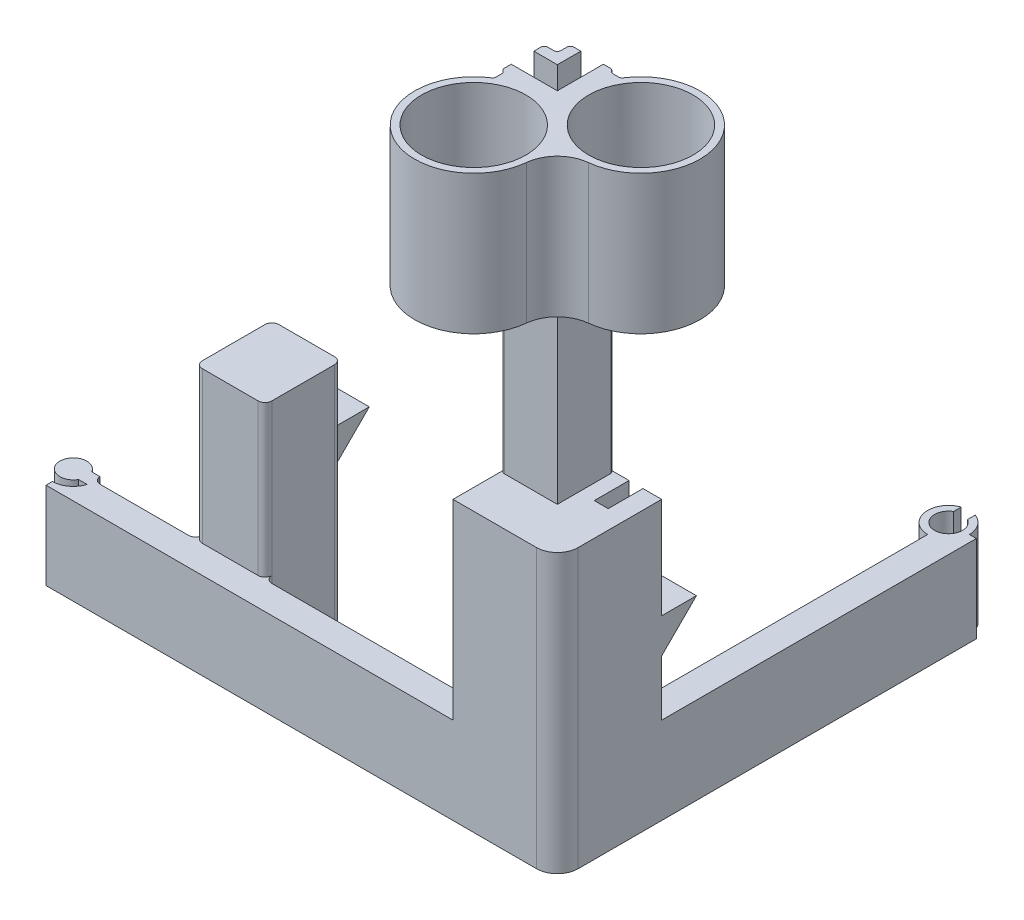
from build123d import *
from build123d.topology import SkipClean

# Parameters (mm, degrees)
SKETCH1_W                 = 30
SKETCH1_H                 = 30
BOSS_EXTRUDE1_DEPTH       = 80
SKETCH2_R                 = 6
BOSS_EXTRUDE2_DEPTH       = 22
CUT_EXTRUDE1_DEPTH        = 83.764726786
BOSS_EXTRUDE3_DEPTH       = 100
BOSS_EXTRUDE5_DEPTH       = 2
BOSS_EXTRUDE6_DEPTH       = 23
BOSS_EXTRUDE7_DEPTH       = 25
FILLET1_R                 = 2
SKETCH11_R                = 6.055782361
CUT_EXTRUDE2_DEPTH        = 2.125
SKETCH12_W                = 13.25
SKETCH12_H                = 8.5
CUT_EXTRUDE4_DEPTH        = 13.25
CUT_EXTRUDE5_REACH        = 204.341
SKETCH15_W                = 3.75
SKETCH15_H                = 3.75
FILLET2_R                 = 1
CUT_EXTRUDE7_START        = 22
SKETCH16_R                = 6
CUT_EXTRUDE7_DEPTH        = 22
SKETCH17_R                = 15
BOSS_EXTRUDE8_DEPTH       = 40
FILLET3_R                 = 1
SKETCH18_R                = 15
SKETCH18_R_2              = 7.5
BOSS_EXTRUDE9_DEPTH       = 2
SKETCH22_W                = 4
SKETCH22_H                = 10
CUT_EXTRUDE8_DEPTH        = 25
BOSS_EXTRUDE10_REACH      = 253.678
SKETCH23_W                = 20
SKETCH23_H                = 22
SKETCH24_W                = 15
SKETCH24_H                = 17
CUT_EXTRUDE9_DEPTH        = 66
FILLET4_R                 = 2
FILLET5_R                 = 2
CHAMFER1_SIZE             = 7
BOSS_EXTRUDE11_DEPTH      = 30
BOSS_EXTRUDE12_DEPTH      = 7.999995
BOSS_EXTRUDE12_DEPTH_BACK = 8.000005


with BuildPart() as part:
    # Sketch1 → Boss-Extrude1 (new body)
    with BuildSketch(Plane(origin=(0, 0, 0), x_dir=(1, 0, 0), z_dir=(0, 1, 0))):
        Rectangle(SKETCH1_W, SKETCH1_H)
    extrude(amount=BOSS_EXTRUDE1_DEPTH)

    # Sketch2 → Boss-Extrude2 (add)
    with BuildSketch(Plane(origin=(0, 80, 0), x_dir=(1, 0, 0), z_dir=(0, 1, 0))):
        with Locations(Location((9, -9, 0), (0, 0, 270))):
            Circle(SKETCH2_R)
    extrude(amount=BOSS_EXTRUDE2_DEPTH)

    # Sketch3 → Cut-Extrude1 (cut, through all)
    with BuildSketch(Plane(origin=(0, 80, 0), x_dir=(1, 0, 0), z_dir=(0, 1, 0))):
        with BuildLine():
            Line((9, -15), (15, -15))
            Line((15, -15), (15, -9))
            ThreePointArc((15, -9), (13.242640687, -13.242640687), (9, -15))
        make_face()
    extrude(amount=-CUT_EXTRUDE1_DEPTH, mode=Mode.SUBTRACT)

    # Sketch4 → Boss-Extrude3 (add)
    with BuildSketch(Plane(origin=(0, 80, 0), x_dir=(1, 0, 0), z_dir=(0, 1, 0))):
        Polygon((-8.25, 11.25), (-8.25, 8.25), (-11.25, 8.25), (-15, 8.25), (-15, 11.25), (-11.25, 11.25), (-11.25, 15), (-8.25, 15), align=None)
        Polygon((-1.75, 1.75), (-11.25, 1.75), (-15, 1.75), (-15, -1.25), (-11.25, -1.25), (1.25, -1.25), (1.25, 11.25), (1.25, 15), (-1.75, 15), (-1.75, 11.25), align=None)
    extrude(amount=BOSS_EXTRUDE3_DEPTH)

    # Sketch6 → Boss-Extrude5 (add)
    with BuildSketch(Plane.XZ):
        with BuildLine():
            Line((15, -15), (7, -15))
            Line((7, -15), (7, -99.5))
            ThreePointArc((7, -99.5), (2.757359313, -109.742640687), (13, -105.5))
            Line((13, -105.5), (15, -105.5))
            Line((15, -105.5), (15, -15))
        make_face()
    extrude(amount=-BOSS_EXTRUDE5_DEPTH)

    # Sketch7 → Boss-Extrude6 (add)
    with SkipClean():  # the faces are left unmerged after this step: merging them gives an invalid solid
        with BuildSketch(Plane(origin=(0, 2, 0), x_dir=(1, 0, 0), z_dir=(0, 1, 0))):
            with BuildLine():
                Line((9, 111.156854249), (9, 108.964101615))
                ThreePointArc((9, 108.964101615), (7, 101.5), (5, 108.964101615))
                Line((5, 108.964101615), (5, 111.156854249))
                ThreePointArc((5, 111.156854249), (1.086408642, 104.485388128), (7, 99.5))
                Line((7, 99.5), (7, 15))
                Line((7, 15), (15, 15))
                Line((15, 15), (15, 105.5))
                Line((15, 105.5), (13, 105.5))
                ThreePointArc((13, 105.5), (11.898979486, 108.964101615), (9, 111.156854249))
            make_face()
        extrude(amount=BOSS_EXTRUDE6_DEPTH)

    # Sketch9 → Boss-Extrude7 (add)
    with SkipClean():  # the faces are left unmerged after this step: merging them gives an invalid solid
        with BuildSketch(Plane.XZ):
            with BuildLine():
                Line((-15, 15), (-15, 7))
                Line((-15, 7), (-126.175, 7))
                ThreePointArc((-126.175, 7), (-126.252697751, 6.037536458), (-126.48377869, 5.1))
                Line((-126.48377869, 5.1), (-128.797778509, 5.1))
                ThreePointArc((-128.797778509, 5.1), (-136.05, 7), (-128.797778509, 8.9))
                Line((-128.797778509, 8.9), (-126.3, 8.9))
                ThreePointArc((-126.3, 8.9), (-128.491885554, 11.955834237), (-132.050001601, 13.173329766))
                Line((-132.050001601, 13.173329766), (-132.050001601, 15))
                Line((-132.050001601, 15), (-15, 15))
            make_face()
        extrude(amount=-BOSS_EXTRUDE7_DEPTH)

    # Fillet1
    fillet1_edges = [part.edges().sort_by_distance(p)[0] for p in [
        (-126.175, 12.5, 7),
    ]]
    fillet(fillet1_edges, radius=FILLET1_R)

    # Sketch11 → Cut-Extrude2 (cut)
    with SkipClean():  # the faces are left unmerged after this step: merging them gives an invalid solid
        with BuildSketch(Plane.XZ):
            with Locations((-132.175, 7)):
                Circle(SKETCH11_R)
        extrude(amount=-CUT_EXTRUDE2_DEPTH, mode=Mode.SUBTRACT)

    # Sketch12 → Cut-Extrude4 (cut)
    with SkipClean():  # the faces are left unmerged after this step: merging them gives an invalid solid
        with BuildSketch(Plane.ZY.offset(15)):
            with Locations((-8.375, 72.75)):
                Rectangle(SKETCH12_W, SKETCH12_H)
        extrude(amount=-CUT_EXTRUDE4_DEPTH, mode=Mode.SUBTRACT)

    # Sketch15 → Cut-Extrude5 (cut, up to next)
    with BuildSketch(Plane(origin=(0, 80, 0), x_dir=(1, 0, 0), z_dir=(0, 1, 0)), mode=Mode.PRIVATE) as cut_extrude5_sk1:
        with Locations((-13.125, 13.125)):
            Rectangle(SKETCH15_W, SKETCH15_H)
    cut_extrude5_tool1 = extrude(cut_extrude5_sk1.sketch, amount=-CUT_EXTRUDE5_REACH, mode=Mode.PRIVATE) & part.part
    add(cut_extrude5_tool1.solids().sort_by_distance((-13.125, 80, -13.125))[0], mode=Mode.SUBTRACT)

    # Fillet2
    fillet2_edges = [part.edges().sort_by_distance(p)[0] for p in [
        (-11.25, 130, -15),
        (-11.25, 130, -11.25),
        (-15, 130, -11.25),
        (-15, 130, 1.25),
        (1.25, 130, -15),
    ]]
    fillet(fillet2_edges, radius=FILLET2_R)

    # Sketch16 → Cut-Extrude7 (cut)
    with SkipClean():  # the faces are left unmerged after this step: merging them gives an invalid solid
        with BuildSketch(Plane(origin=(0, 80, 0), x_dir=(1, 0, 0), z_dir=(0, 1, 0)).offset(CUT_EXTRUDE7_START)):
            with Locations((9, -9)):
                Circle(SKETCH16_R)
        extrude(amount=-CUT_EXTRUDE7_DEPTH, mode=Mode.SUBTRACT)


with BuildPart() as cut_extrude7_kept_piece:
    # of the separate pieces the step leaves, the one the design keeps (cut_extrude7_pieces_kept)
    add(part.part.solids().sort_by_distance((-15, 80, 0.25))[0])

    # Sketch17 → Boss-Extrude8 (add)
    with SkipClean():  # the faces are left unmerged after this step: merging them gives an invalid solid
        with BuildSketch(Plane(origin=(0, 180, 0), x_dir=(1, 0, 0), z_dir=(0, 1, 0))):
            with BuildLine():
                Line((-14, -1.25), (-14, -4.216394713))
                ThreePointArc((-14, -4.216394713), (-14.384018227, -33.129332993), (11.657578086, -20.561885701))
                ThreePointArc((11.657578086, -20.561885701), (14.532144442, -14.532144442), (20.561885701, -11.657578086))
                ThreePointArc((20.561885701, -11.657578086), (33.129332993, 14.384018227), (4.216394713, 14))
                Line((4.216394713, 14), (1.25, 14))
                Line((1.25, 14), (1.25, -1.25))
                Line((1.25, -1.25), (-14, -1.25))
            make_face()
            with Locations(Location((18.79163056, 5.25, 0), (0, 0, 270))):
                Circle(SKETCH17_R, mode=Mode.SUBTRACT)
            with Locations(Location((-5.25, -18.79163056, 0), (0, 0, 270))):
                Circle(SKETCH17_R, mode=Mode.SUBTRACT)
        extrude(amount=-BOSS_EXTRUDE8_DEPTH)

    # Fillet3
    # the kernel refuses this fillet: 1 mm, written as the material it adds along each edge
    with BuildSketch(Plane(origin=(-14, 140, 1.25), x_dir=(-0.9659258262890684, 0, -0.25881904510252046), z_dir=(0, 1, 0))) as fillet3_piece_1:
        with BuildLine():
            CenterArc((0.776457135, 0.965925826), FILLET3_R, 195, 60)
            Line((-0.189468691, 0.707106781), (0, 0))
            ThreePointArc((0, 0), (0.258819045, 0.034074174), (0.51763809, 0))
        make_face()
    extrude(amount=40)
    with BuildSketch(Plane(origin=(-14, 180, 4.216394713), x_dir=(0, 0, -1), z_dir=(0, -1, 0))) as fillet3_piece_2:
        with BuildLine():
            CenterArc((0.555444904, -1), FILLET3_R, 90, 57.202831704)
            ThreePointArc((-0.285148471, -0.458333333), (-0.140754957, -0.230298516), (0, 0))
            Line((0, 0), (0.555444904, 0))
        make_face()
    extrude(amount=40)
    with BuildSketch(Plane(origin=(1.25, 140, -14), x_dir=(-0.2588190451025201, 0, -0.9659258262890685), z_dir=(0, 1, 0))) as fillet3_piece_3:
        with BuildLine():
            CenterArc((0.776457135, -0.965925826), FILLET3_R, 105, 60)
            Line((-0.189468691, -0.707106781), (0, 0))
            ThreePointArc((0, 0), (0.258819045, -0.034074174), (0.51763809, 0))
        make_face()
    extrude(amount=40)
    with BuildSketch(Plane(origin=(4.216394713, 180, -14), x_dir=(-1, 0, 0), z_dir=(0, -1, 0))) as fillet3_piece_4:
        with BuildLine():
            CenterArc((0.555444904, 1), FILLET3_R, 212.797168296, 57.202831704)
            ThreePointArc((-0.285148471, 0.458333333), (-0.140754957, 0.230298516), (0, 0))
            Line((0, 0), (0.555444904, 0))
        make_face()
    extrude(amount=40)

    # Sketch18 → Boss-Extrude9 (add)
    with SkipClean():  # the faces are left unmerged after this step: merging them gives an invalid solid
        with BuildSketch(Plane.XZ.offset(-140)):
            with Locations(Location((-5.25, 18.79163056, 0), (0, 0, 90))):
                Circle(SKETCH18_R)
            with Locations(Location((-5.25, 18.79163056, 0), (0, 0, 270))):
                Circle(SKETCH18_R_2, mode=Mode.SUBTRACT)
        boss_extrude9 = extrude(amount=-BOSS_EXTRUDE9_DEPTH)

    # Sketch21 → Revolve1 (revolve)
    with SkipClean():  # the faces are left unmerged after this step: merging them gives an invalid solid
        with BuildSketch(Plane(origin=(-5.25, 0, 0), x_dir=(0, 0, -1), z_dir=(-1, 0, 0)), mode=Mode.PRIVATE) as revolve1_sk:
            Polygon((-11.29163056, -142), (-3.79163056, -154.5), (-3.79163056, -142), align=None)
        revolve1 = revolve(revolve1_sk.sketch.rotate(Axis((-5.25, 1065, 18.79163056), (0, -1, 0)), 180), axis=Axis((-5.25, 1065, 18.79163056), (0, -1, 0)))

    # Mirror1: Boss-Extrude9, Revolve1 across plane
    with SkipClean():  # the faces are left unmerged after this step: merging them gives an invalid solid
        add(boss_extrude9.mirror(Plane(origin=(0, 0, 0), x_dir=(0.7071067811865478, 0, 0.7071067811865472), z_dir=(0.7071067811865475, 0, -0.7071067811865477))))
        add(revolve1.mirror(Plane(origin=(0, 0, 0), x_dir=(0.7071067811865478, 0, 0.7071067811865472), z_dir=(0.7071067811865475, 0, -0.7071067811865477))))

    # Sketch22 → Cut-Extrude8 (cut)
    with SkipClean():  # the faces are left unmerged after this step: merging them gives an invalid solid
        with BuildSketch(Plane(origin=(0, 80, 0), x_dir=(1, 0, 0), z_dir=(0, 1, 0))):
            with Locations((7.625, 10)):
                Rectangle(SKETCH22_W, SKETCH22_H)
        extrude(amount=-CUT_EXTRUDE8_DEPTH, mode=Mode.SUBTRACT)

    # Boss-Extrude10: up to this face of the body (flat: up to its plane)
    boss_extrude10_end = Plane(cut_extrude7_kept_piece.part.faces().sort_by_distance((-8.375, 68.5, -8.375))[0])
    # Sketch23 → Boss-Extrude10 (add, up to the picked face)
    with BuildSketch(Plane.XZ, mode=Mode.PRIVATE) as boss_extrude10_sk1:
        with Locations((-87.071774981, -4)):
            Rectangle(SKETCH23_W, SKETCH23_H)
    boss_extrude10_tool1 = split(extrude(boss_extrude10_sk1.sketch, amount=-BOSS_EXTRUDE10_REACH, mode=Mode.PRIVATE), bisect_by=boss_extrude10_end, keep=Keep.BOTH, mode=Mode.PRIVATE)
    add(boss_extrude10_tool1.solids().sort_by(Axis((-87.071775, 0, -4), (0, 1, 0)))[0])

    # Sketch24 → Cut-Extrude9 (cut)
    with SkipClean():  # the faces are left unmerged after this step: merging them gives an invalid solid
        with BuildSketch(Plane.XZ):
            with Locations((-87.071774981, -4)):
                Rectangle(SKETCH24_W, SKETCH24_H)
        extrude(amount=-CUT_EXTRUDE9_DEPTH, mode=Mode.SUBTRACT)

    # Fillet4
    fillet4_edges = [cut_extrude7_kept_piece.edges().sort_by_distance(p)[0] for p in [
        (-97.071774981, 34.25, -15),
        (-97.071774981, 12.5, 7),
        (-77.071774981, 12.5, 7),
        (-77.071774981, 34.25, -15),
    ]]
    fillet(fillet4_edges, radius=FILLET4_R)

    # Fillet5
    fillet5_edges = [cut_extrude7_kept_piece.edges().sort_by_distance(p)[0] for p in [
        (-77.071774981, 46.75, 7),
        (-97.071774981, 46.75, 7),
    ]]
    fillet(fillet5_edges, radius=FILLET5_R)

    # Chamfer1
    chamfer1_edges = [cut_extrude7_kept_piece.edges().sort_by_distance(p)[0] for p in [
        (-94.571774981, 66, -4),
        (-87.071774981, 66, 4.5),
        (-79.571774981, 66, -4),
        (-87.071774981, 66, -12.5),
    ]]
    chamfer(chamfer1_edges, length=CHAMFER1_SIZE)

    # Sketch26 → Boss-Extrude11 (add)
    with SkipClean():  # the faces are left unmerged after this step: merging them gives an invalid solid
        with BuildSketch(Plane(origin=(15, 0, 0), x_dir=(0, 0, -1), z_dir=(1, 0, 0))):
            Polygon((15, 51), (25, 51), (15, 41), align=None)
        extrude(amount=-BOSS_EXTRUDE11_DEPTH)

    # Sketch27 → Boss-Extrude12 (add, two sides: drawn at the far end of the back side and taken through both)
    with SkipClean():  # the faces are left unmerged after this step: merging them gives an invalid solid
        with BuildSketch(Plane.ZY.offset(87.071774981).offset(-BOSS_EXTRUDE12_DEPTH_BACK)):
            Polygon((-15, 51), (-25, 51), (-15, 41), align=None)
        extrude(amount=BOSS_EXTRUDE12_DEPTH + BOSS_EXTRUDE12_DEPTH_BACK)


solid = cut_extrude7_kept_piece.part
